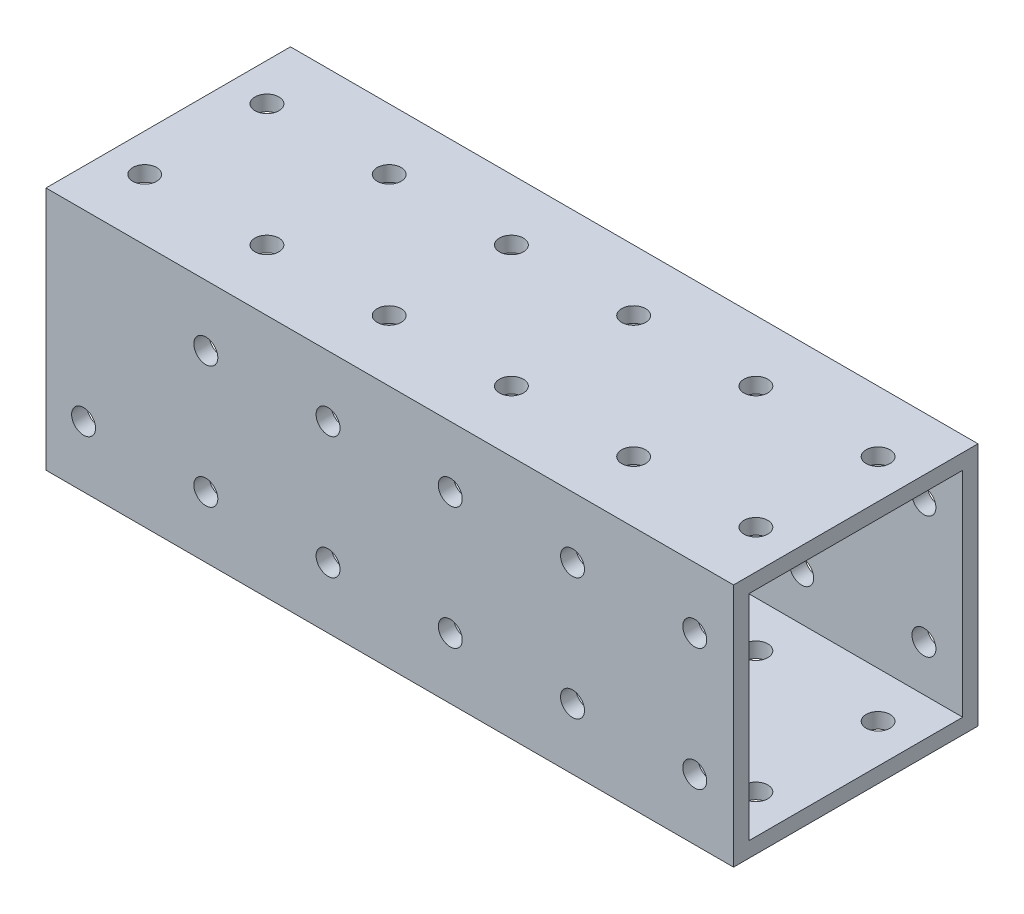
from build123d import *

# Parameters (mm, degrees)
SKETCH1_W           = 50.8
SKETCH1_H           = 50.8
BOSS_EXTRUDE1_DEPTH = 142.875
SHELL1_T            = -3.175
SKETCH2_R           = 2.4892
CUT_EXTRUDE1_DEPTH  = 160.920435295
SKETCH3_R           = 2.4892
CUT_EXTRUDE2_DEPTH  = 160.920435295
LPATTERN1_COUNT     = 6
LPATTERN1_PITCH     = 25.4


with BuildPart() as part:
    # Sketch1 → Boss-Extrude1 (new body)
    with BuildSketch(Plane(origin=(0, 0, 0), x_dir=(0, 0, -1), z_dir=(1, 0, 0))):
        with Locations((25.4, 25.4)):
            Rectangle(SKETCH1_W, SKETCH1_H)
    extrude(amount=BOSS_EXTRUDE1_DEPTH)

    # Shell1
    shell1_openings = [part.faces().sort_by_distance(p)[0] for p in [
        (0, 25.4, -25.4),
        (142.875, 25.4, -25.4),
    ]]
    offset(amount=SHELL1_T, openings=shell1_openings, kind=Kind.INTERSECTION)

    # Sketch2 → Cut-Extrude1 (cut, through all)
    with BuildSketch(Plane(origin=(0, 0, -50.8), x_dir=(-1, 0, 0), z_dir=(0, 0, -1))):
        with Locations((-134.813330442, 38.1)):
            Circle(SKETCH2_R)
        with Locations((-109.413330442, 38.1)):
            Circle(SKETCH2_R)
        with Locations((-84.013330442, 38.1)):
            Circle(SKETCH2_R)
        with Locations((-58.613330442, 38.1)):
            Circle(SKETCH2_R)
        with Locations((-33.213330442, 38.1)):
            Circle(SKETCH2_R)
        with Locations((-33.213330442, 12.7)):
            Circle(SKETCH2_R)
        with Locations((-58.613330442, 12.7)):
            Circle(SKETCH2_R)
        with Locations((-84.013330442, 12.7)):
            Circle(SKETCH2_R)
        with Locations((-109.413330442, 12.7)):
            Circle(SKETCH2_R)
        with Locations((-134.813330442, 12.7)):
            Circle(SKETCH2_R)
        with Locations((-7.813330442, 12.7)):
            Circle(SKETCH2_R)
    extrude(amount=-CUT_EXTRUDE1_DEPTH, mode=Mode.SUBTRACT)

    # Sketch3 → Cut-Extrude2 (cut, through all)
    with BuildSketch(Plane.XZ):
        with Locations((134.813330442, -12.7)):
            Circle(SKETCH3_R)
        with Locations((134.813330442, -38.1)):
            Circle(SKETCH3_R)
    cut_extrude2 = extrude(amount=-CUT_EXTRUDE2_DEPTH, mode=Mode.SUBTRACT)

    # LPattern1: Cut-Extrude2 ×6
    with Locations(*[(-i * LPATTERN1_PITCH, 0, 0) for i in range(1, LPATTERN1_COUNT)]):
        add(cut_extrude2, mode=Mode.SUBTRACT)


solid = part.part
